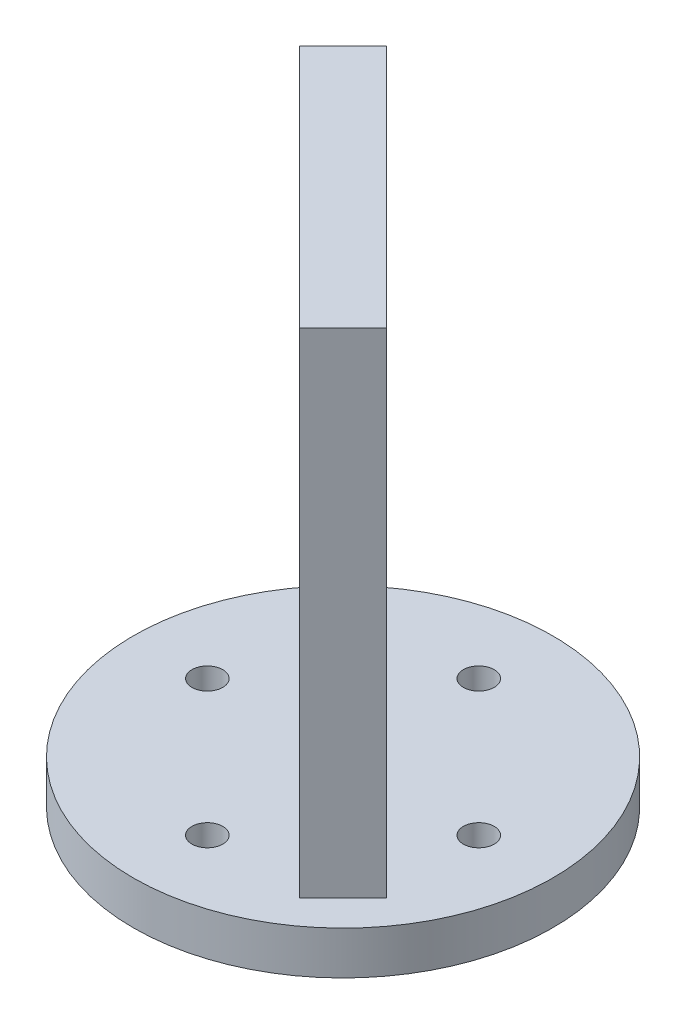
from build123d import *

# Parameters (mm, degrees)
SKETCH_1_R          = 34
EXTRUDE_1_DEPTH     = 7
SKETCH_2_R          = 2.5
CUT_EXTRUDE_1_DEPTH = 7
EXTRUDE_2_DEPTH     = 40
SKETCH_4_W          = 56
SKETCH_4_H          = 80
EXTRUDE_3_DEPTH     = 10


with BuildPart() as part:
    # 草图1 → 凸台-拉伸1 (new body)
    with BuildSketch(Plane(origin=(0, 0, 0), x_dir=(1, 0, 0), z_dir=(0, 1, 0))):
        Circle(SKETCH_1_R)
    extrude(amount=EXTRUDE_1_DEPTH)

    # 草图2 → 切除-拉伸1 (cut)
    with BuildSketch(Plane(origin=(0, 7, 0), x_dir=(1, 0, 0), z_dir=(0, 1, 0))):
        with Locations((22, 0)):
            Circle(SKETCH_2_R)
        with Locations((0, -22)):
            Circle(SKETCH_2_R)
        with Locations((-22, 0)):
            Circle(SKETCH_2_R)
        with Locations((0, 22)):
            Circle(SKETCH_2_R)
    extrude(amount=-CUT_EXTRUDE_1_DEPTH, mode=Mode.SUBTRACT)

    # 草图3 → 凸台-拉伸2 (add)
    with BuildSketch(Plane(origin=(0, 7, 0), x_dir=(1, 0, 0), z_dir=(0, 1, 0))):
        Polygon((-16.263455967, 23.334523779), (-23.334523779, 16.263455967), (16.263455967, -23.334523779), (23.334523779, -16.263455967), align=None)
    extrude(amount=EXTRUDE_2_DEPTH)

    # 草图4 → 凸台-拉伸3 (add)
    with BuildSketch(Plane(origin=(-3.535533906, 0, 3.535533906), x_dir=(0.7071067811865479, 0, 0.7071067811865472), z_dir=(-0.7071067811865472, 0, 0.7071067811865479))):
        with Locations((0, 47)):
            Rectangle(SKETCH_4_W, SKETCH_4_H)
    extrude(amount=-EXTRUDE_3_DEPTH)


solid = part.part
